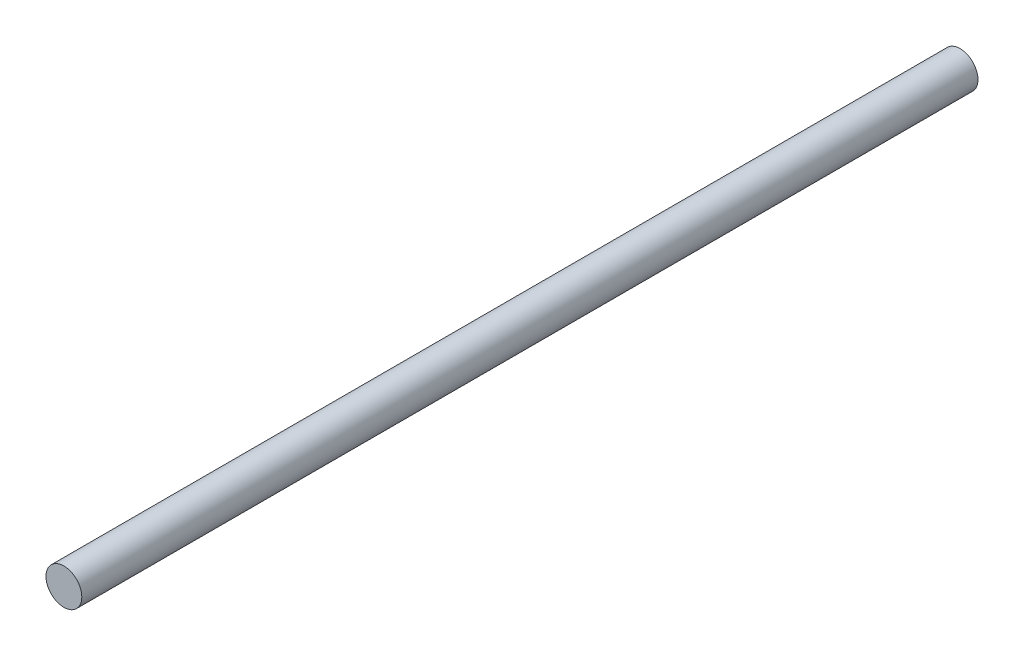
from build123d import *

# Parameters (mm, degrees)
SKETCH_1_R        = 2
EXTRUDE_303_DEPTH = 100


with BuildPart() as part:
    # Эскиз1 → Extrude 303 (new body)
    with BuildSketch(Plane.XY):
        Circle(SKETCH_1_R)
    extrude(amount=EXTRUDE_303_DEPTH)


solid = part.part
